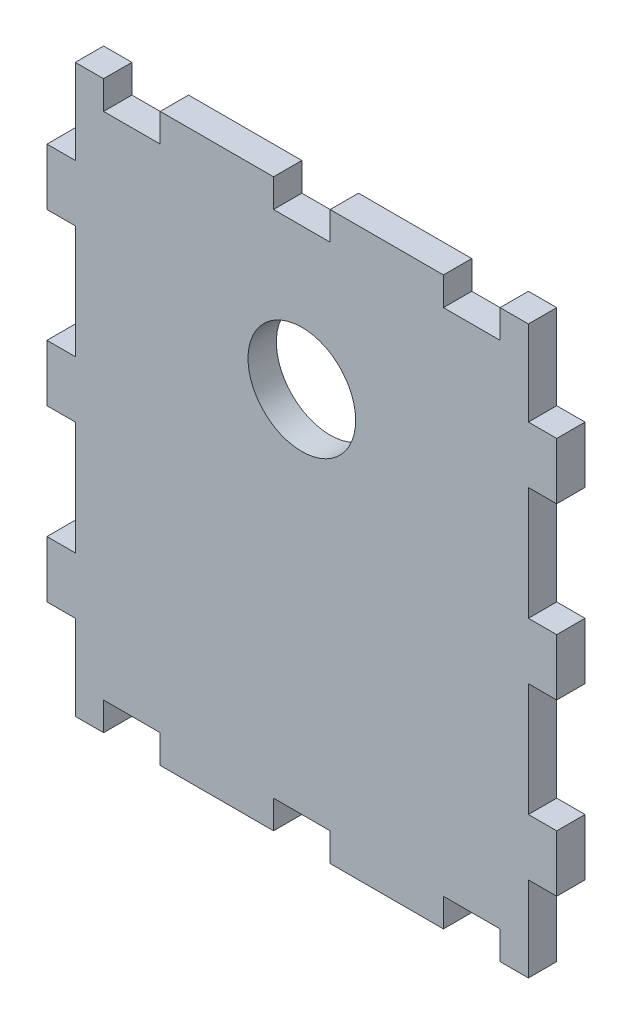
from build123d import *

# Parameters (mm, degrees)
SKETCH1_R           = 9.5
BOSS_EXTRUDE1_DEPTH = 5


with BuildPart() as part:
    # Sketch1 → Boss-Extrude1 (new body)
    with BuildSketch(Plane.XY):
        Polygon((-35, 45), (-35, 50), (-40, 50), (-40, 35), (-45, 35), (-45, 25), (-40, 25), (-40, 5), (-45, 5), (-45, -5), (-40, -5), (-40, -25), (-45, -25), (-45, -35), (-40, -35), (-40, -50), (-35, -50), (-35, -45), (-25, -45), (-25, -50), (-5, -50), (-5, -45), (5, -45), (5, -50), (25, -50), (25, -45), (35, -45), (35, -50), (40, -50), (40, -35), (45, -35), (45, -25), (40, -25), (40, -5), (45, -5), (45, 5), (40, 5), (40, 25), (45, 25), (45, 35), (40, 35), (40, 50), (35, 50), (35, 45), (25, 45), (25, 50), (5, 50), (5, 45), (-5, 45), (-5, 50), (-25, 50), (-25, 45), align=None)
        with Locations((0, 20)):
            Circle(SKETCH1_R, mode=Mode.SUBTRACT)
    extrude(amount=BOSS_EXTRUDE1_DEPTH)


solid = part.part
